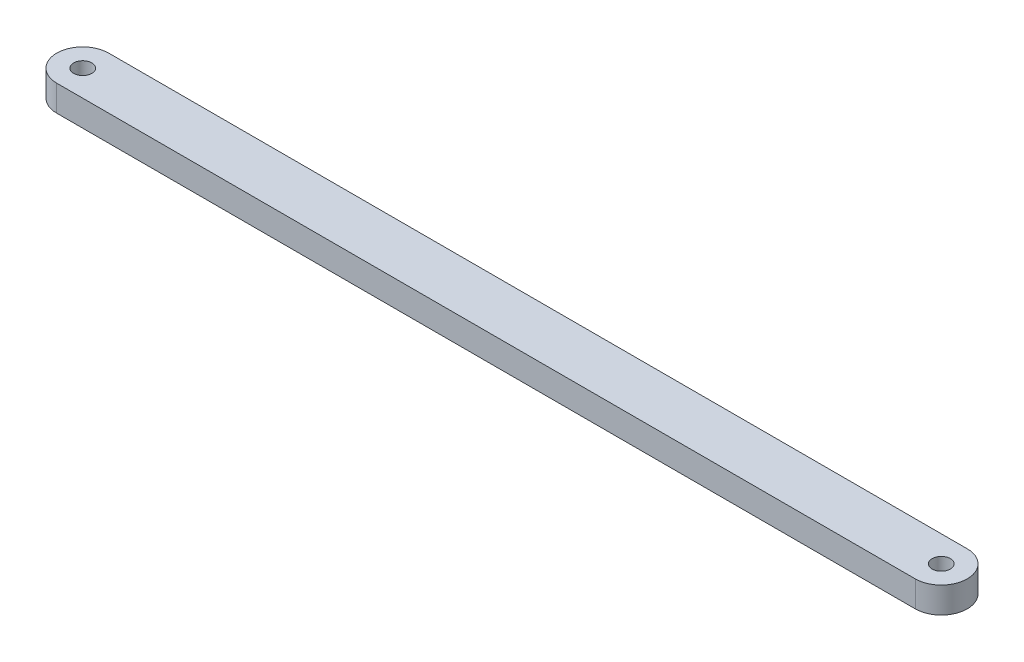
from build123d import *

# Parameters (mm, degrees)
SKETCH1_R           = 3.5
BOSS_EXTRUDE1_DEPTH = 10


with BuildPart() as part:
    # Sketch1 → Boss-Extrude1 (new body)
    with BuildSketch(Plane(origin=(0, 0, 0), x_dir=(1, 0, 0), z_dir=(0, 1, 0))):
        with BuildLine():
            Line((-165, 10), (165, 10))
            ThreePointArc((165, 10), (175, 0), (165, -10))
            Line((165, -10), (-165, -10))
            ThreePointArc((-165, -10), (-175, 0), (-165, 10))
        make_face()
        with Locations((-165, 0)):
            Circle(SKETCH1_R, mode=Mode.SUBTRACT)
        with Locations((165, 0)):
            Circle(SKETCH1_R, mode=Mode.SUBTRACT)
    extrude(amount=BOSS_EXTRUDE1_DEPTH)


solid = part.part
